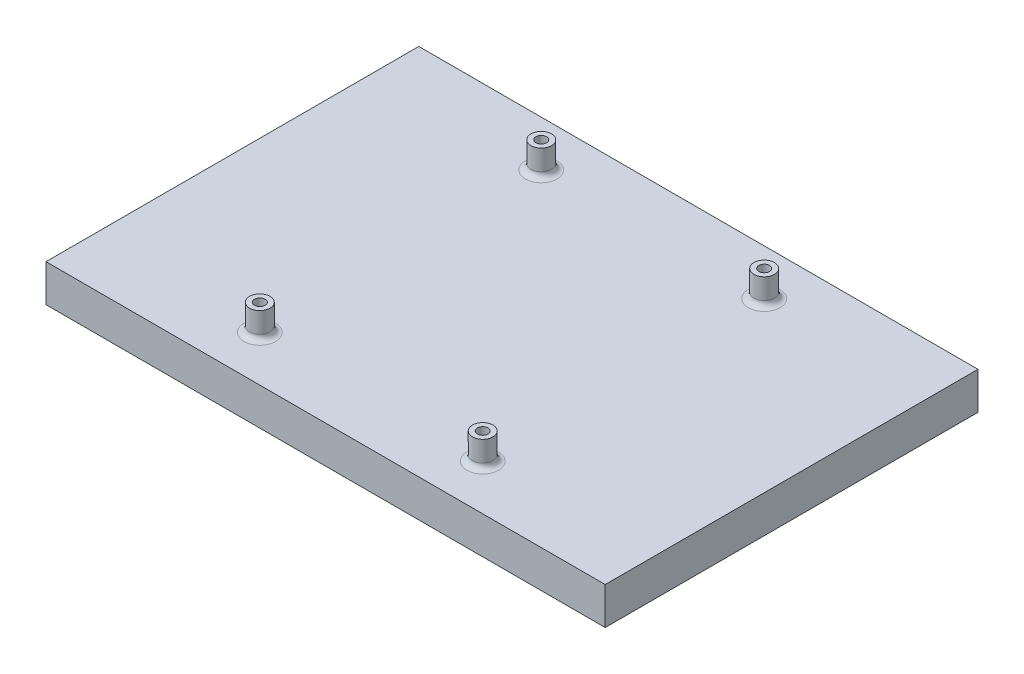
from build123d import *

# Parameters (mm, degrees)
SKETCH1_W                 = 150
SKETCH1_H                 = 100
BOSS_EXTRUDE1_DEPTH       = 10
SKETCH2_R                 = 2.75
BOSS_EXTRUDE2_DEPTH       = 7
F_1_0MM_DOWEL_HOLE1_D     = 2.85
F_1_0MM_DOWEL_HOLE1_DEPTH = 10
F_1_0MM_DOWEL_HOLE1_TIP   = 0.856226382
FILLET1_R                 = 1.5


with BuildPart() as part:
    # Sketch1 → Boss-Extrude1 (new body)
    with BuildSketch(Plane(origin=(0, 0, 0), x_dir=(1, 0, 0), z_dir=(0, 1, 0))):
        Rectangle(SKETCH1_W, SKETCH1_H)
    extrude(amount=BOSS_EXTRUDE1_DEPTH)

    # Sketch2 → Boss-Extrude2 (add)
    with BuildSketch(Plane(origin=(0, 10, 0), x_dir=(1, 0, 0), z_dir=(0, 1, 0))):
        with Locations((29.9, 37.75)):
            Circle(SKETCH2_R)
        with Locations((29.9, -37.75)):
            Circle(SKETCH2_R)
        with Locations((-29.9, -37.75)):
            Circle(SKETCH2_R)
        with Locations((-29.9, 37.75)):
            Circle(SKETCH2_R)
    extrude(amount=BOSS_EXTRUDE2_DEPTH)

    # Ø1.0mm Dowel Hole1
    with Locations(Plane(origin=(0, 17, 0), x_dir=(1, 0, 0), z_dir=(0, 1, 0))):
        with Locations((-29.9, 37.75), (29.9, 37.75), (29.9, -37.75), (-29.9, -37.75)):
            Hole(F_1_0MM_DOWEL_HOLE1_D / 2, depth=F_1_0MM_DOWEL_HOLE1_DEPTH)
            with Locations((0, 0, -(F_1_0MM_DOWEL_HOLE1_DEPTH + F_1_0MM_DOWEL_HOLE1_TIP / 2))):  # 118° drill point
                Cone(0, F_1_0MM_DOWEL_HOLE1_D / 2, F_1_0MM_DOWEL_HOLE1_TIP, mode=Mode.SUBTRACT)

    # Fillet1
    fillet1_edges = [part.edges().sort_by_distance(p)[0] for p in [
        (27.15, 10, 37.75),
        (-32.65, 10, 37.75),
        (27.15, 10, -37.75),
        (-32.65, 10, -37.75),
    ]]
    fillet(fillet1_edges, radius=FILLET1_R)


solid = part.part
